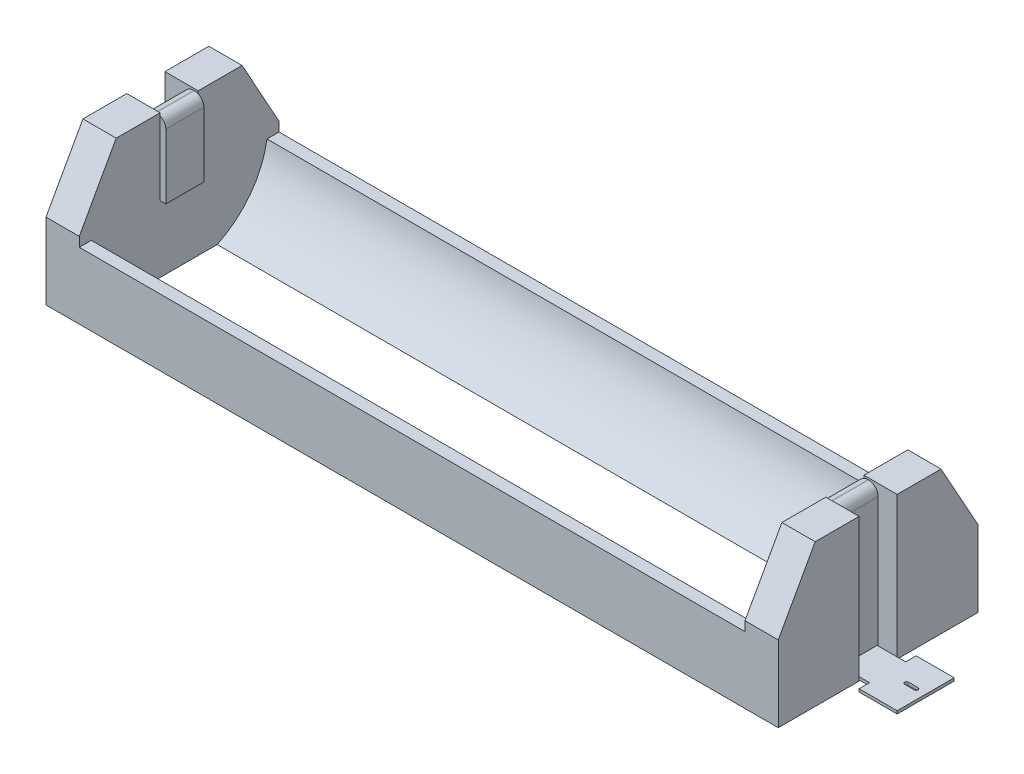
from build123d import *
from OCP.BRepFilletAPI import BRepFilletAPI_MakeChamfer

# Parameters (mm, degrees)
DODANIE_WYCI_GNI_CIE1_DEPTH   = 15
DODANIE_WYCI_GNI_CIE1_2_DEPTH = 15
SZKIC1_3_W                    = 70
SZKIC1_3_H                    = 6.5
DODANIE_WYCI_GNI_CIE2_DEPTH   = 7
SZKIC2_R                      = 9.35
WYTNIJ_WYCI_GNI_CIE1_DEPTH    = 70
DODANIE_WYCI_GNI_CIE3_DEPTH   = 0.3
SFAZOWANIE1_SIZE              = 7
SFAZOWANIE1_SIZE2             = 3.88016336
WYTNIJ_WYCI_GNI_CIE2_REACH    = 82.607
SZKIC4_W                      = 4
SZKIC4_H                      = 0.2
SZKIC4_3_W                    = 4
SZKIC4_3_H                    = 7.8
DODANIE_WYCI_GNI_CIE4_DEPTH   = 0.6
ZAOKR_GLENIE1_R               = 1


with BuildPart() as part:
    # Szkic1 → Dodanie-wyciągnięcie1 (new body)
    with BuildSketch(Plane(origin=(0, 0, 0), x_dir=(1, 0, 0), z_dir=(0, 1, 0))):
        Polygon((-38.5, -2), (-38.5, -10.5), (-35, -10.5), (-35, 10.5), (-38.5, 10.5), (-38.5, 2), (-36.5, 2), (-36.5, -2), align=None)
    extrude(amount=DODANIE_WYCI_GNI_CIE1_DEPTH)



with BuildPart() as body_2:
    # Szkic1 → Dodanie-wyci_gni_cie1 2 (new body)
    with BuildSketch(Plane(origin=(0, 0, 0), x_dir=(1, 0, 0), z_dir=(0, 1, 0))):
        Polygon((35, 10.5), (35, -10.5), (38.5, -10.5), (38.5, -2), (36.5, -2), (36.5, 2), (38.5, 2), (38.5, 10.5), align=None)
    extrude(amount=DODANIE_WYCI_GNI_CIE1_2_DEPTH)


with BuildPart() as part_1:
    add(part.part)

    add(body_2.part)  # Dodanie-wyciągnięcie2 merges body 2
    # Szkic1<3> → Dodanie-wyciągnięcie2 (add)
    with BuildSketch(Plane(origin=(0, 0, 0), x_dir=(1, 0, 0), z_dir=(0, 1, 0))):
        with Locations((0, -7.25)):
            Rectangle(SZKIC1_3_W, SZKIC1_3_H)
        with Locations((0, 7.25)):
            Rectangle(SZKIC1_3_W, SZKIC1_3_H)
    extrude(amount=DODANIE_WYCI_GNI_CIE2_DEPTH)

    # Szkic2 → Wytnij-wyciągnięcie1 (cut)
    with BuildSketch(Plane(origin=(-35, 0, 0), x_dir=(0, 0, -1), z_dir=(1, 0, 0))):
        with Locations((0, 8.451183349)):
            Circle(SZKIC2_R)
    extrude(amount=WYTNIJ_WYCI_GNI_CIE1_DEPTH, mode=Mode.SUBTRACT)

    # Szkic3 → Dodanie-wyciągnięcie3 (add)
    with BuildSketch(Plane(origin=(0, 0, 0), x_dir=(1, 0, 0), z_dir=(0, 1, 0))):
        with BuildLine():
            Line((-36.5, 0), (-36.5, 1.9))
            Line((-36.5, 1.9), (-39.5, 1.9))
            Line((-39.5, 1.9), (-39.5, 3))
            Line((-39.5, 3), (-43.5, 3))
            Line((-43.5, 3), (-43.5, 0))
            Line((-43.5, 0), (-42.7, 0))
            ThreePointArc((-42.7, 0), (-42.641421356, 0.141421356), (-42.5, 0.2))
            Line((-42.5, 0.2), (-41.5, 0.2))
            ThreePointArc((-41.5, 0.2), (-41.358578644, 0.141421356), (-41.3, 0))
            Line((-41.3, 0), (-36.5, 0))
        make_face()
        with BuildLine():
            Line((-36.5, -1.9), (-36.5, 0))
            Line((-36.5, 0), (-41.3, 0))
            ThreePointArc((-41.3, 0), (-41.358578644, -0.141421356), (-41.5, -0.2))
            Line((-41.5, -0.2), (-42.5, -0.2))
            ThreePointArc((-42.5, -0.2), (-42.641421356, -0.141421356), (-42.7, 0))
            Line((-42.7, 0), (-43.5, 0))
            Line((-43.5, 0), (-43.5, -3))
            Line((-43.5, -3), (-39.5, -3))
            Line((-39.5, -3), (-39.5, -1.9))
            Line((-39.5, -1.9), (-36.5, -1.9))
        make_face()
        with BuildLine():
            Line((41.5, 0.2), (42.5, 0.2))
            ThreePointArc((42.5, 0.2), (42.641421356, 0.141421356), (42.7, 0))
            Line((42.7, 0), (43.5, 0))
            Line((43.5, 0), (43.5, 3))
            Line((43.5, 3), (39.5, 3))
            Line((39.5, 3), (39.5, 1.9))
            Line((39.5, 1.9), (36.5, 1.9))
            Line((36.5, 1.9), (36.5, 0))
            Line((36.5, 0), (41.3, 0))
            ThreePointArc((41.3, 0), (41.358578644, 0.141421356), (41.5, 0.2))
        make_face()
        with BuildLine():
            Line((43.5, 0), (42.7, 0))
            ThreePointArc((42.7, 0), (42.641421356, -0.141421356), (42.5, -0.2))
            Line((42.5, -0.2), (41.5, -0.2))
            ThreePointArc((41.5, -0.2), (41.358578644, -0.141421356), (41.3, 0))
            Line((41.3, 0), (36.5, 0))
            Line((36.5, 0), (36.5, -1.9))
            Line((36.5, -1.9), (39.5, -1.9))
            Line((39.5, -1.9), (39.5, -3))
            Line((39.5, -3), (43.5, -3))
            Line((43.5, -3), (43.5, 0))
        make_face()
    extrude(amount=DODANIE_WYCI_GNI_CIE3_DEPTH)

    # Sfazowanie1: one chamfer whose edges measure the first distance from different faces: ONE call of the kernel's chamfer builder (chamfer() names one face for all edges)
    sfazowanie1_edges_1 = [part_1.edges().sort_by_distance(p)[0] for p in [
        (-36.75, 15, 10.5),
        (36.75, 15, 10.5),
    ]]
    sfazowanie1_side_1 = [part_1.faces().sort_by_distance(p)[0] for p in [
        (0, 4.205882353, 10.5),
    ]]
    sfazowanie1_edges_2 = [part_1.edges().sort_by_distance(p)[0] for p in [
        (-36.75, 15, -10.5),
        (36.75, 15, -10.5),
    ]]
    sfazowanie1_side_2 = [part_1.faces().sort_by_distance(p)[0] for p in [
        (0, 4.205882353, -10.5),
    ]]
    sfazowanie1 = BRepFilletAPI_MakeChamfer(part_1.part.solid().wrapped)
    for e in sfazowanie1_edges_1:
        sfazowanie1.Add(SFAZOWANIE1_SIZE, SFAZOWANIE1_SIZE2, e.wrapped, sfazowanie1_side_1[0].wrapped)  # the first distance lies on this face
    for e in sfazowanie1_edges_2:
        sfazowanie1.Add(SFAZOWANIE1_SIZE, SFAZOWANIE1_SIZE2, e.wrapped, sfazowanie1_side_2[0].wrapped)  # the first distance lies on this face
    add(Compound.cast(sfazowanie1.Shape()), mode=Mode.REPLACE)

    # Szkic4 → Wytnij-wyciągnięcie2 (cut, up to next)
    with BuildSketch(Plane(origin=(-35, 0, 0), x_dir=(0, 0, -1), z_dir=(1, 0, 0)), mode=Mode.PRIVATE) as wytnij_wyci_gni_cie2_sk1:
        with Locations((0, 14.9)):
            Rectangle(SZKIC4_W, SZKIC4_H)
    wytnij_wyci_gni_cie2_tool1 = extrude(wytnij_wyci_gni_cie2_sk1.sketch, amount=-WYTNIJ_WYCI_GNI_CIE2_REACH, mode=Mode.PRIVATE) & part_1.part
    wytnij_wyci_gni_cie2 = wytnij_wyci_gni_cie2_tool1.solids().sort_by_distance((-35, 14.9, 0))[0]
    add(wytnij_wyci_gni_cie2, mode=Mode.SUBTRACT)

    # Szkic4<3> → Dodanie-wyciągnięcie4 (add)
    with BuildSketch(Plane(origin=(-35, 0, 0), x_dir=(0, 0, -1), z_dir=(1, 0, 0))):
        with Locations((0, 10.9)):
            Rectangle(SZKIC4_3_W, SZKIC4_3_H)
    dodanie_wyci_gni_cie4 = extrude(amount=DODANIE_WYCI_GNI_CIE4_DEPTH)

    # Lustro1: Wytnij-wyciągnięcie2, Dodanie-wyciągnięcie4 across plane
    add(wytnij_wyci_gni_cie2.mirror(Plane(origin=(0, 0, 0), x_dir=(0, 0, 1), z_dir=(1, 0, 0))), mode=Mode.SUBTRACT)
    add(dodanie_wyci_gni_cie4.mirror(Plane(origin=(0, 0, 0), x_dir=(0, 0, 1), z_dir=(1, 0, 0))))

    # Zaokrąglenie1
    # the kernel refuses this fillet: 1 mm, written as the material it takes off along each edge
    with BuildSketch(Plane(origin=(-36.5, 14.8, -2), x_dir=(0, -1, 0), z_dir=(0, 0, 1)), Plane(origin=(-34.4, 14.8, -2), x_dir=(-1, 0, 0), z_dir=(0, 0, 1))) as zaokr_glenie1_piece_1:
        with BuildLine():
            CenterArc((ZAOKR_GLENIE1_R, ZAOKR_GLENIE1_R), ZAOKR_GLENIE1_R, 180, 90)
            Line((0, ZAOKR_GLENIE1_R), (0, 0))
            Line((0, 0), (ZAOKR_GLENIE1_R, 0))
        make_face()
    extrude(amount=4, mode=Mode.SUBTRACT)
    with BuildSketch(Plane(origin=(36.5, 14.8, -2), x_dir=(0, -1, 0), z_dir=(0, 0, 1)), Plane(origin=(34.4, 14.8, -2), x_dir=(1, 0, 0), z_dir=(0, 0, 1))) as zaokr_glenie1_piece_2:
        with BuildLine():
            CenterArc((ZAOKR_GLENIE1_R, -ZAOKR_GLENIE1_R), ZAOKR_GLENIE1_R, 90, 90)
            Line((0, -ZAOKR_GLENIE1_R), (0, 0))
            Line((0, 0), (ZAOKR_GLENIE1_R, 0))
        make_face()
    extrude(amount=4, mode=Mode.SUBTRACT)


solid = part_1.part
